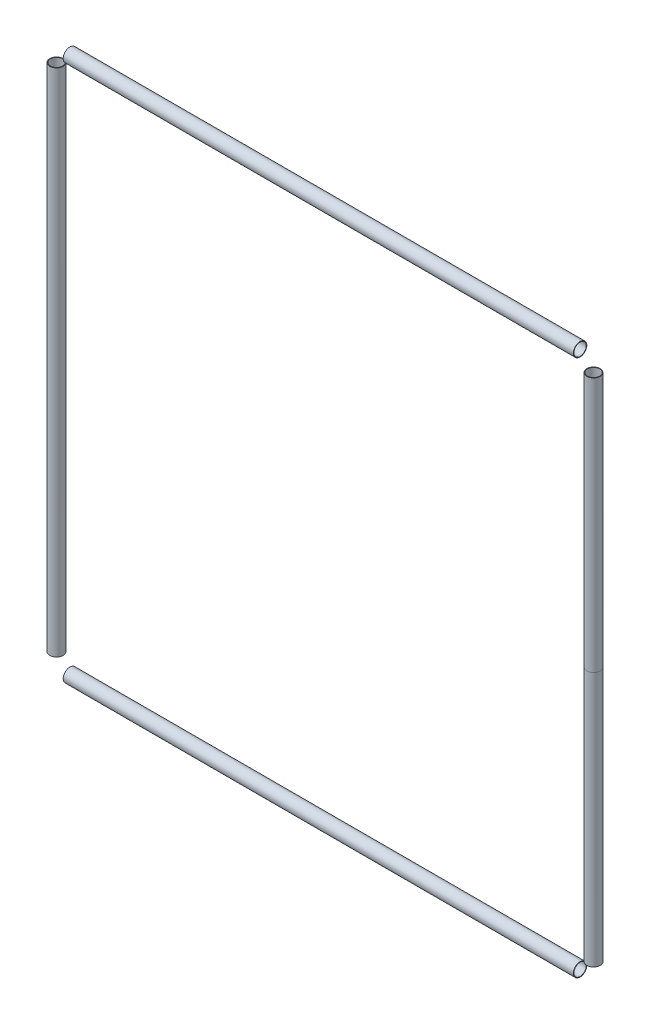
from build123d import *

# Parameters (mm, degrees)
SKETCH3_R               = 3.175
SKETCH3_R_2             = 2.921
CUT_EXTRUDE1_DEPTH      = 185.122627276
CUT_EXTRUDE1_DEPTH_BACK = 185.122627276
SKETCH4_W               = 12.7
SKETCH4_H               = 12.7


with BuildPart() as part:
    # Sweep1: sweep along a path in Sketch1
    with BuildLine(Plane.XY) as sweep1_path:
        Line((-127, 127), (127, 127))
        Line((127, 127), (127, -127))
        Line((127, -127), (-127, -127))
        Line((-127, -127), (-127, 127))
    # Sketch3 → Sweep1 (sweep)
    with BuildSketch(Plane(origin=(0, 0, 0), x_dir=(1, 0, 0), z_dir=(0, 1, 0))):
        with Locations((127, 0)):
            Circle(SKETCH3_R)
        with Locations((127, 0)):
            Circle(SKETCH3_R_2, mode=Mode.SUBTRACT)
    sweep(path=sweep1_path.line, transition=Transition.RIGHT)

    # Sketch4 → Cut-Extrude1 (cut, two sides: drawn at the far end of the back side and taken through both)
    with BuildSketch(Plane.XY.offset(-CUT_EXTRUDE1_DEPTH_BACK)):
        with Locations((127, 127)):
            Rectangle(SKETCH4_W, SKETCH4_H)
        with Locations((-127, 127)):
            Rectangle(SKETCH4_W, SKETCH4_H)
        with Locations((-127, -127)):
            Rectangle(SKETCH4_W, SKETCH4_H)
        with Locations((127, -127)):
            Rectangle(SKETCH4_W, SKETCH4_H)
    extrude(amount=CUT_EXTRUDE1_DEPTH + CUT_EXTRUDE1_DEPTH_BACK, mode=Mode.SUBTRACT)


with BuildPart() as cut_extrude1_piece_1:
    # of the separate pieces the step leaves, piece 1, a body of its own (cut_extrude1_pieces)
    add(part.part.solids().sort_by_distance((130.175, 120.65, 0))[0])


with BuildPart() as cut_extrude1_piece_2:
    # of the separate pieces the step leaves, piece 2, a body of its own (cut_extrude1_pieces)
    add(part.part.solids().sort_by_distance((-120.65, 130.175, 0))[0])


with BuildPart() as cut_extrude1_piece_3:
    # of the separate pieces the step leaves, piece 3, a body of its own (cut_extrude1_pieces)
    add(part.part.solids().sort_by_distance((-130.175, -120.65, 0))[0])


with BuildPart() as cut_extrude1_piece_4:
    # of the separate pieces the step leaves, piece 4, a body of its own (cut_extrude1_pieces)
    add(part.part.solids().sort_by_distance((120.65, -130.175, 0))[0])


solid = Compound([cut_extrude1_piece_1.part, cut_extrude1_piece_2.part, cut_extrude1_piece_3.part, cut_extrude1_piece_4.part])
